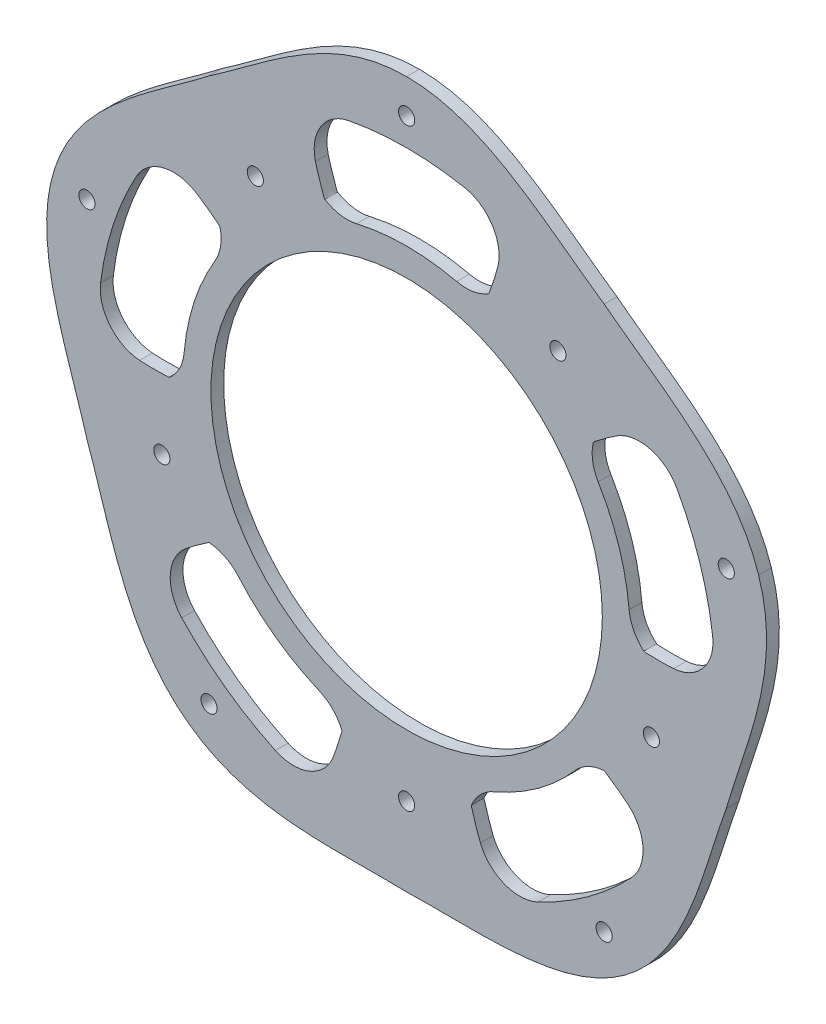
from build123d import *

# Parameters (mm, degrees)
SZKIC1_R                    = 1.9
SZKIC1_R_2                  = 46
DODANIE_WYCI_GNI_CIE1_DEPTH = 3
WYTNIJ_WYCI_GNI_CIE1_DEPTH  = 10
SZYK_KO_OWY1_COUNT          = 5


with BuildPart() as part:
    # Szkic1 → Dodanie-wyciągnięcie1 (new body)
    with BuildSketch(Plane.XY):
        with BuildLine():
            add(Edge.make_bspline(
                [(0, 87), (18.224844976, 86.998612649), (32.288902875, 73.536902698), (46.435034931, 63.912342556)],
                knots=[0, 0, 0, 0, 1, 1, 1, 1], degree=3))
            add(Edge.make_bspline(
                [(0, 87), (-18.224844976, 86.998612649), (-32.288902875, 73.536902698), (-46.435034931, 63.912342556)],
                knots=[0, 0, 0, 0, 1, 1, 1, 1], degree=3))
            add(Edge.make_bspline(
                [(-82.741916918, 26.884478511), (-77.108810651, 44.216907368), (-59.959930782, 53.43272413), (-46.435034931, 63.912342556)],
                knots=[0, 0, 0, 0, 1, 1, 1, 1], degree=3))
            add(Edge.make_bspline(
                [(-82.741916918, 26.884478511), (-88.372384286, 9.551192223), (-79.915570217, -7.984418835), (-75.133464787, -24.412342556)],
                knots=[0, 0, 0, 0, 1, 1, 1, 1], degree=3))
            add(Edge.make_bspline(
                [(-51.137316949, -70.384478511), (-65.88071079, -59.671061018), (-69.346178061, -40.513663074), (-75.133464787, -24.412342556)],
                knots=[0, 0, 0, 0, 1, 1, 1, 1], degree=3))
            add(Edge.make_bspline(
                [(-51.137316949, -70.384478511), (-36.39229218, -81.095651222), (-17.10163575, -78.471544919), (0, -79)],
                knots=[0, 0, 0, 0, 1, 1, 1, 1], degree=3))
            add(Edge.make_bspline(
                [(51.137316949, -70.384478511), (36.39229218, -81.095651222), (17.10163575, -78.471544919), (0, -79)],
                knots=[0, 0, 0, 0, 1, 1, 1, 1], degree=3))
            add(Edge.make_bspline(
                [(51.137316949, -70.384478511), (65.88071079, -59.671061018), (69.346178061, -40.513663074), (75.133464787, -24.412342556)],
                knots=[0, 0, 0, 0, 1, 1, 1, 1], degree=3))
            add(Edge.make_bspline(
                [(82.741916918, 26.884478511), (88.372384286, 9.551192223), (79.915570217, -7.984418835), (75.133464787, -24.412342556)],
                knots=[0, 0, 0, 0, 1, 1, 1, 1], degree=3))
            add(Edge.make_bspline(
                [(82.741916918, 26.884478511), (77.108810651, 44.216907368), (59.959930782, 53.43272413), (46.435034931, 63.912342556)],
                knots=[0, 0, 0, 0, 1, 1, 1, 1], degree=3))
        make_face()
        with Locations((-46.435034931, -63.912342556)):
            Circle(SZKIC1_R, mode=Mode.SUBTRACT)
        with Locations((75.133464787, 24.412342556)):
            Circle(SZKIC1_R, mode=Mode.SUBTRACT)
        with Locations((46.435034931, -63.912342556)):
            Circle(SZKIC1_R, mode=Mode.SUBTRACT)
        with Locations((-75.133464787, 24.412342556)):
            Circle(SZKIC1_R, mode=Mode.SUBTRACT)
        with Locations((0, 79)):
            Circle(SZKIC1_R, mode=Mode.SUBTRACT)
        with Locations((35.561007764, 48.94552816)):
            Circle(SZKIC1_R, mode=Mode.SUBTRACT)
        with Locations((-57.538919236, -18.69552816)):
            Circle(SZKIC1_R, mode=Mode.SUBTRACT)
        with Locations((0, -60.5)):
            Circle(SZKIC1_R, mode=Mode.SUBTRACT)
        with Locations((57.538919236, -18.69552816)):
            Circle(SZKIC1_R, mode=Mode.SUBTRACT)
        with Locations((-35.561007764, 48.94552816)):
            Circle(SZKIC1_R, mode=Mode.SUBTRACT)
        Circle(SZKIC1_R_2, mode=Mode.SUBTRACT)
    extrude(amount=DODANIE_WYCI_GNI_CIE1_DEPTH)

    # Szkic2 → Wytnij-wyciągnięcie1 (cut)
    with BuildSketch(Plane.XY.offset(3)):
        with BuildLine():
            ThreePointArc((-10.630538234, 51.412465967), (0, 52.5), (10.630538234, 51.412465967))
            ThreePointArc((10.630538234, 51.412465967), (11.195947731, 51.292306971), (11.76, 51.165930071))
            ThreePointArc((11.76, 51.165930071), (15.603436359, 51.041208976), (19.209763629, 52.376110475))
            add(Edge.make_bspline(
                [(19.209763629, 52.376110475), (19.383881121, 52.482382931), (20.427218615, 55.389296859), (21.242063067, 58.205934941), (21.437779376, 59.001735196)],
                knots=[0.234741565, 0.234741565, 0.234741565, 0.234741565, 0.256093935, 0.345793148, 0.345793148, 0.345793148, 0.345793148], degree=3))
            ThreePointArc((21.437779376, 59.001735196), (20.143741061, 66.790013303), (13.60348343, 71.212325047))
            ThreePointArc((13.60348343, 71.212325047), (0, 72.5), (-13.60348343, 71.212325047))
            ThreePointArc((-13.60348343, 71.212325047), (-20.143741061, 66.790013303), (-21.437779376, 59.001735196))
            add(Edge.make_bspline(
                [(-19.209763629, 52.376110475), (-19.383881121, 52.482382931), (-20.427218615, 55.389296859), (-21.242063067, 58.205934941), (-21.437779376, 59.001735196)],
                knots=[0.234741565, 0.234741565, 0.234741565, 0.234741565, 0.256093935, 0.345793148, 0.345793148, 0.345793148, 0.345793148], degree=3))
            ThreePointArc((-19.209763629, 52.376110475), (-15.603436359, 51.041208976), (-11.76, 51.165930071))
            ThreePointArc((-11.76, 51.165930071), (-11.195947731, 51.292306971), (-10.630538234, 51.412465967))
        make_face()
    wytnij_wyci_gni_cie1 = extrude(amount=-WYTNIJ_WYCI_GNI_CIE1_DEPTH, mode=Mode.SUBTRACT)

    # Szyk kołowy1: Wytnij-wyciągnięcie1 ×5 about axis
    szyk_ko_owy1_axis = Axis((0, 0, 0), (0, 0, 1))
    for i in range(1, SZYK_KO_OWY1_COUNT):
        add(wytnij_wyci_gni_cie1.rotate(szyk_ko_owy1_axis, i * 360 / SZYK_KO_OWY1_COUNT), mode=Mode.SUBTRACT)


solid = part.part
